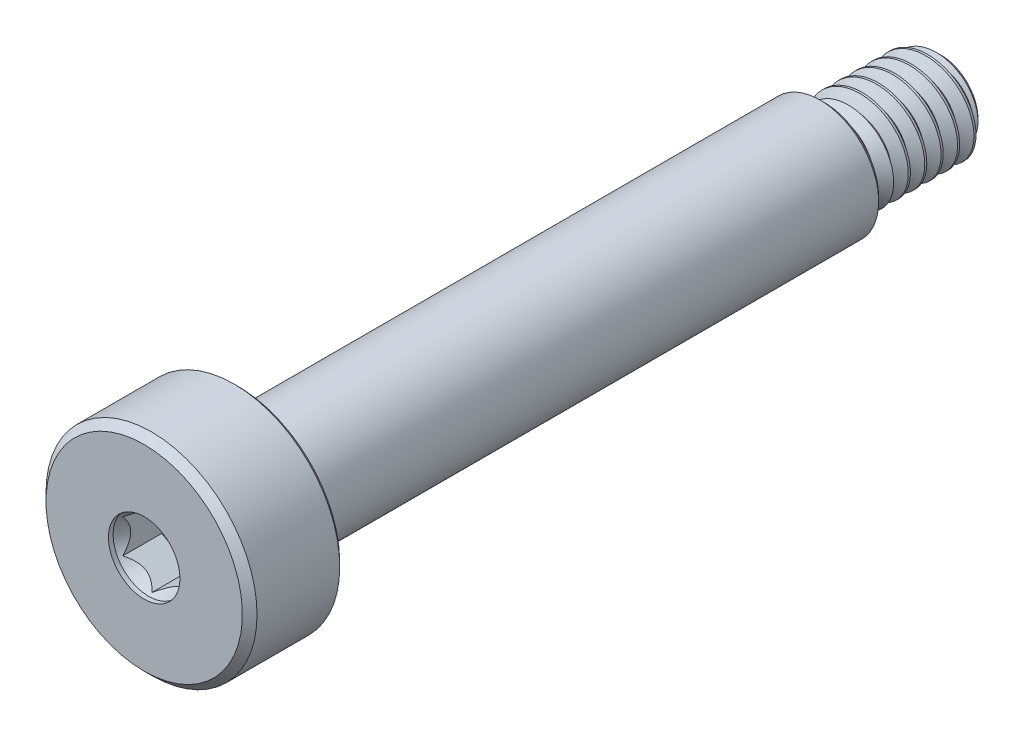
from build123d import *

# Parameters (mm, degrees)
CUT_EXTRUDE1_DEPTH = 2
SKETCH4_R          = 1.525
CUT_EXTRUDE2_DEPTH = 0.2
CUT_EXTRUDE3_START = -0.2
SKETCH4_2_R        = 1.525
CUT_EXTRUDE3_DEPTH = 1.5
CUT_EXTRUDE3_DRAFT = -30
CUT_SWEEP1_PITCH   = 0.7


with BuildPart() as part:
    # Sketch2 → Revolve1 (revolve)
    with BuildSketch(Plane(origin=(0, 0, 0), x_dir=(0, 0, -1), z_dir=(1, 0, 0)), mode=Mode.PRIVATE) as revolve1_sk:
        with BuildLine():
            Line((17, 0), (17, 1.5625))
            Line((17, 1.5625), (16.5625, 2))
            Line((16.5625, 2), (13.031995005, 2))
            Line((13.031995005, 2), (12.577331668, 1.545336663))
            Line((12.577331668, 1.545336663), (12.227331668, 1.545336663))
            ThreePointArc((12.227331668, 1.545336663), (12.066583904, 1.611920567), (12, 1.772668332))
            Line((12, 1.772668332), (12, 2.325))
            Line((12, 2.325), (11.825, 2.5))
            Line((11.825, 2.5), (-11.936847276, 2.5))
            Line((-11.936847276, 2.5), (-12.2888, 2.2968))
            Line((-12.2888, 2.2968), (-12.3777, 2.2968))
            ThreePointArc((-12.3777, 2.2968), (-12.81773255, 2.47906745), (-13, 2.9191))
            Line((-13, 2.9191), (-13, 4.34))
            Line((-13, 4.34), (-13.16, 4.5))
            Line((-13.16, 4.5), (-16.6876, 4.5))
            Line((-16.6876, 4.5), (-17, 4.1876))
            Line((-17, 4.1876), (-17, 0))
            Line((-17, 0), (17, 0))
        make_face()
    revolve(revolve1_sk.sketch.rotate(Axis((0, 0, 17), (0, 0, -1)), 180), axis=Axis((0, 0, 17), (0, 0, -1)))

    # Sketch3 → Cut-Extrude1 (cut)
    with BuildSketch(Plane.XY.offset(17)):
        Polygon((0, 1.443375673), (-1.25, 0.721687836), (-1.25, -0.721687836), (0, -1.443375673), (1.25, -0.721687836), (1.25, 0.721687836), align=None)
    extrude(amount=-CUT_EXTRUDE1_DEPTH, mode=Mode.SUBTRACT)

    # Sketch4 → Cut-Extrude2 (cut)
    with BuildSketch(Plane.XY.offset(17)):
        Circle(SKETCH4_R)
    extrude(amount=-CUT_EXTRUDE2_DEPTH, mode=Mode.SUBTRACT)


with BuildPart() as cut_extrude3_tool:
    # Sketch4<2> → Cut-Extrude3 (with draft: the straight prism first)
    with BuildSketch(Plane.XY.offset(17).offset(CUT_EXTRUDE3_START)):
        Circle(SKETCH4_2_R)
    extrude(amount=-CUT_EXTRUDE3_DEPTH)
    # Cut-Extrude3: the draft: its side faces are tilted about the plane it starts from
    cut_extrude3_sides = [cut_extrude3_tool.faces().sort_by_distance(p)[0] for p in [
        (-1.525, 0, 16.05),
    ]]
    draft(cut_extrude3_sides, Plane.XY.offset(17).offset(CUT_EXTRUDE3_START), CUT_EXTRUDE3_DRAFT)


with BuildPart() as part_1:
    add(part.part)

    # Cut-Extrude3: cut by cut_extrude3_tool
    add(cut_extrude3_tool.part, mode=Mode.SUBTRACT)

    # Cut-Sweep1: the profile of Sketch6 profile screwed along a right-hand helix of 6.642857 turns, 6 arcs to a turn; built about Z, then put on its axis
    cut_sweep1_z = Axis((0, 0, 0), (0, 0, 1))
    cut_sweep1_corners = [(2.037888611, 0, 0.021875), (2.037888611, 0, -0.634375), (1.545036663, 0, -0.349826795), (1.545036663, 0, -0.262673205)]
    with BuildLine(mode=Mode.PRIVATE) as cut_sweep1_profile:
        Line(cut_sweep1_corners[0], cut_sweep1_corners[1])
        Line(cut_sweep1_corners[1], cut_sweep1_corners[2])
        Line(cut_sweep1_corners[2], cut_sweep1_corners[3])
        Line(cut_sweep1_corners[3], cut_sweep1_corners[0])
    cut_sweep1_cap = Face(cut_sweep1_profile.wire())
    cut_sweep1_turn_angles = [0, 30, 60, 90, 120, 150, 180, 210, 240, 270, 300, 330, 360]
    cut_sweep1_turn_weights = [1, 0.8660254037844387, 1, 0.8660254037844387, 1, 0.8660254037844387, 1, 0.8660254037844387, 1, 0.8660254037844387, 1, 0.8660254037844387, 1]
    cut_sweep1_turn_rails = [Edge.make_bspline([Vector(p[0], p[1], 0).rotate(cut_sweep1_z, cut_sweep1_turn_angles[k]) / cut_sweep1_turn_weights[k] + Vector(0, 0, p[2] + CUT_SWEEP1_PITCH * cut_sweep1_turn_angles[k] / 360) for k in range(13)], [0, 0, 0, 1, 1, 2, 2, 3, 3, 4, 4, 5, 5, 6, 6, 6], 2, cut_sweep1_turn_weights) for p in cut_sweep1_corners]
    cut_sweep1_turn_sides = [Face.make_surface_from_curves(cut_sweep1_turn_rails[p[0]], cut_sweep1_turn_rails[p[1]]) for p in [(0, 1), (1, 2), (2, 3), (3, 0)]]
    cut_sweep1_last_angles = [2160, 2190, 2220, 2250, 2280, 2310, 2340, 2365.714285714, 2391.428571429]
    cut_sweep1_last_weights = [1, 0.8660254037844387, 1, 0.8660254037844387, 1, 0.8660254037844387, 1, 0.9009688679023928, 1]
    cut_sweep1_last_rails = [Edge.make_bspline([Vector(p[0], p[1], 0).rotate(cut_sweep1_z, cut_sweep1_last_angles[k]) / cut_sweep1_last_weights[k] + Vector(0, 0, p[2] + CUT_SWEEP1_PITCH * cut_sweep1_last_angles[k] / 360) for k in range(9)], [0, 0, 0, 1, 1, 2, 2, 3, 3, 4, 4, 4], 2, cut_sweep1_last_weights) for p in cut_sweep1_corners]
    cut_sweep1_last_sides = [Face.make_surface_from_curves(cut_sweep1_last_rails[p[0]], cut_sweep1_last_rails[p[1]]) for p in [(0, 1), (1, 2), (2, 3), (3, 0)]]
    cut_sweep1 = Plane(origin=(0, 0, -17), x_dir=(0, 1, 0), z_dir=(0, 0, 1)) * Solid(Shell([*[p.moved(Location((0, 0, CUT_SWEEP1_PITCH * i))) for i in range(6) for p in cut_sweep1_turn_sides], *cut_sweep1_last_sides, cut_sweep1_cap, cut_sweep1_cap.rotate(cut_sweep1_z, 2391.428571429).moved(Location((0, 0, CUT_SWEEP1_PITCH * 2391.428571429 / 360)))]))
    add(cut_sweep1, mode=Mode.SUBTRACT)


solid = part_1.part
